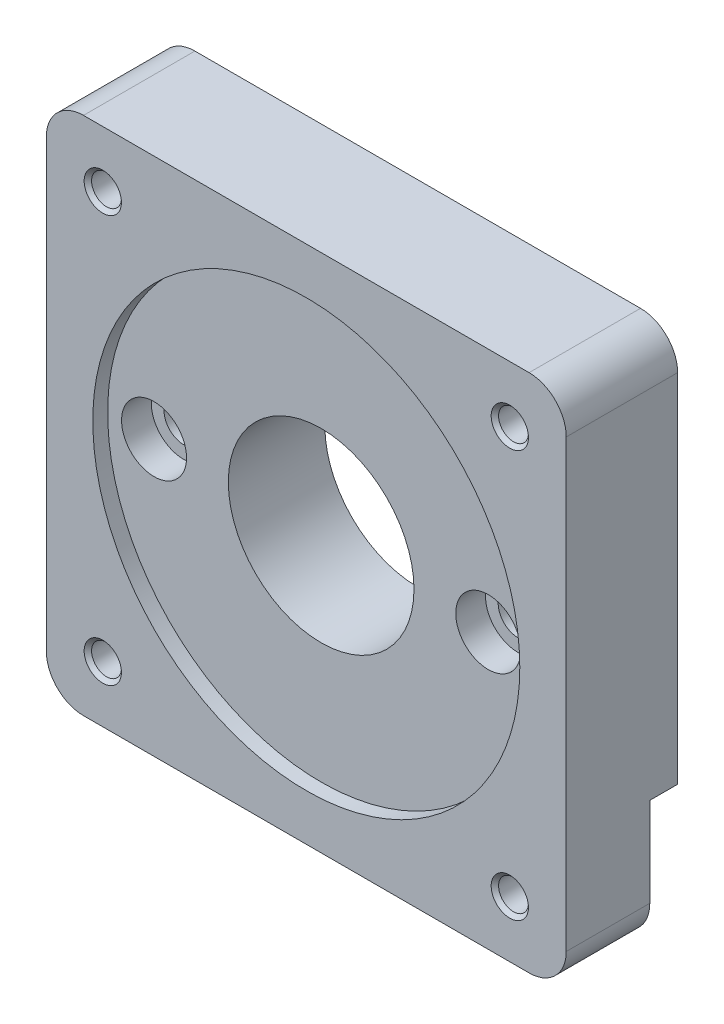
from build123d import *

# Parameters (mm, degrees)
SKETCH1_W                                     = 88.9
SKETCH1_H                                     = 88.9
BOSS_EXTRUDE1_DEPTH                           = 19.05
SKETCH2_R                                     = 36.51
CUT_EXTRUDE1_DEPTH                            = 2.54
SKETCH5_R                                     = 15.875
CUT_EXTRUDE3_DEPTH                            = 65.993731236
SKETCH4_W                                     = 4.7625
SKETCH4_H                                     = 21.59
CUT_EXTRUDE2_DEPTH                            = 102.202346811
FILLET1_R                                     = 6.35
CBORE_FOR_1_4_SOCKET_HEAD_CAP_SCREW1_AT_COUNT = 2
CBORE_FOR_1_4_SOCKET_HEAD_CAP_SCREW1_AT_PITCH = 57.15


# Read off the part's stored shape, not the designer's step: 1/4-20 Tapped Hole2
with BuildPart() as part:
    # Sketch1 → Boss-Extrude1 (new body)
    with BuildSketch(Plane.XY):
        Rectangle(SKETCH1_W, SKETCH1_H)
    extrude(amount=BOSS_EXTRUDE1_DEPTH)

    # Sketch2 → Cut-Extrude1 (cut)
    with BuildSketch(Plane.XY.offset(19.05)):
        Circle(SKETCH2_R)
    extrude(amount=-CUT_EXTRUDE1_DEPTH, mode=Mode.SUBTRACT)

    # Sketch5 → Cut-Extrude3 (cut, through all)
    with BuildSketch(Plane.XY.offset(16.51)):
        Circle(SKETCH5_R)
    extrude(amount=-CUT_EXTRUDE3_DEPTH, mode=Mode.SUBTRACT)

    # Sketch4 → Cut-Extrude2 (cut, through all)
    with BuildSketch(Plane.ZY.offset(44.45)):
        with Locations((2.38125, -33.655)):
            Rectangle(SKETCH4_W, SKETCH4_H)
    extrude(amount=-CUT_EXTRUDE2_DEPTH, mode=Mode.SUBTRACT)

    # Fillet1
    fillet1_edges = [part.edges().sort_by_distance(p)[0] for p in [
        (44.45, -44.45, 11.90625),
        (-44.45, -44.45, 11.90625),
        (-44.45, 44.45, 9.525),
        (44.45, 44.45, 9.525),
    ]]
    fillet(fillet1_edges, radius=FILLET1_R)

    # 1/4-20 Tapped Hole2 outline → 1/4-20 Tapped Hole2 (revolve, cut)
    with BuildSketch(Plane(origin=(34.8, 34.8, 0), x_dir=(1, 0, 0), z_dir=(0, -1, 0))):
        Polygon((0, 0), (3.1877, 0), (2.5527, 0.635), (2.5527, 18.415), (3.1877, 19.05), (0, 19.05), align=None)
    revolve(axis=Axis((34.8, 34.8, 0), (0, 0, 1)), mode=Mode.SUBTRACT)

    # 1_4-20 Tapped Hole2 2 outline → 1_4-20 Tapped Hole2 2 (revolve, cut)
    with BuildSketch(Plane(origin=(-34.8, -34.8, 0), x_dir=(1, 0, 0), z_dir=(0, -1, 0))):
        Polygon((0, 4.7625), (3.1877, 4.7625), (2.5527, 5.3975), (2.5527, 18.415), (3.1877, 19.05), (0, 19.05), align=None)
    revolve(axis=Axis((-34.8, -34.8, 0), (0, 0, 1)), mode=Mode.SUBTRACT)

    # 1_4-20 Tapped Hole2 3 outline → 1_4-20 Tapped Hole2 3 (revolve, cut)
    with BuildSketch(Plane(origin=(-34.8, 34.8, 0), x_dir=(1, 0, 0), z_dir=(0, -1, 0))):
        Polygon((0, 0), (3.1877, 0), (2.5527, 0.635), (2.5527, 18.415), (3.1877, 19.05), (0, 19.05), align=None)
    revolve(axis=Axis((-34.8, 34.8, 0), (0, 0, 1)), mode=Mode.SUBTRACT)

    # 1_4-20 Tapped Hole2 4 outline → 1_4-20 Tapped Hole2 4 (revolve, cut)
    with BuildSketch(Plane(origin=(34.8, -34.8, 0), x_dir=(1, 0, 0), z_dir=(0, -1, 0))):
        Polygon((0, 4.7625), (3.1877, 4.7625), (2.5527, 5.3975), (2.5527, 18.415), (3.1877, 19.05), (0, 19.05), align=None)
    revolve(axis=Axis((34.8, -34.8, 0), (0, 0, 1)), mode=Mode.SUBTRACT)

    # Sketch9 → CBORE for 1/4 Socket Head Cap Screw1 (revolve, cut)
    with BuildSketch(Plane(origin=(28.575, 0, 19.05), x_dir=(0, -1, 0), z_dir=(1, 0, 0))):
        Polygon((0, 0), (0, 19.05), (4.0132, 19.05), (3.3782, 18.415), (3.3782, 7.62), (5.55625, 7.62), (5.55625, 0.635), (6.19125, 0), align=None)
    cbore_for_1_4_socket_head_cap_screw1 = revolve(axis=Axis((28.575, 0, 25.4), (0, 0, -1)), mode=Mode.SUBTRACT)

    # CBORE for 1/4 Socket Head Cap Screw1 at: CBORE for 1/4 Socket Head Cap Screw1 ×2
    with Locations(*[(-i * CBORE_FOR_1_4_SOCKET_HEAD_CAP_SCREW1_AT_PITCH, 0, 0) for i in range(1, CBORE_FOR_1_4_SOCKET_HEAD_CAP_SCREW1_AT_COUNT)]):
        add(cbore_for_1_4_socket_head_cap_screw1, mode=Mode.SUBTRACT)


solid = part.part
